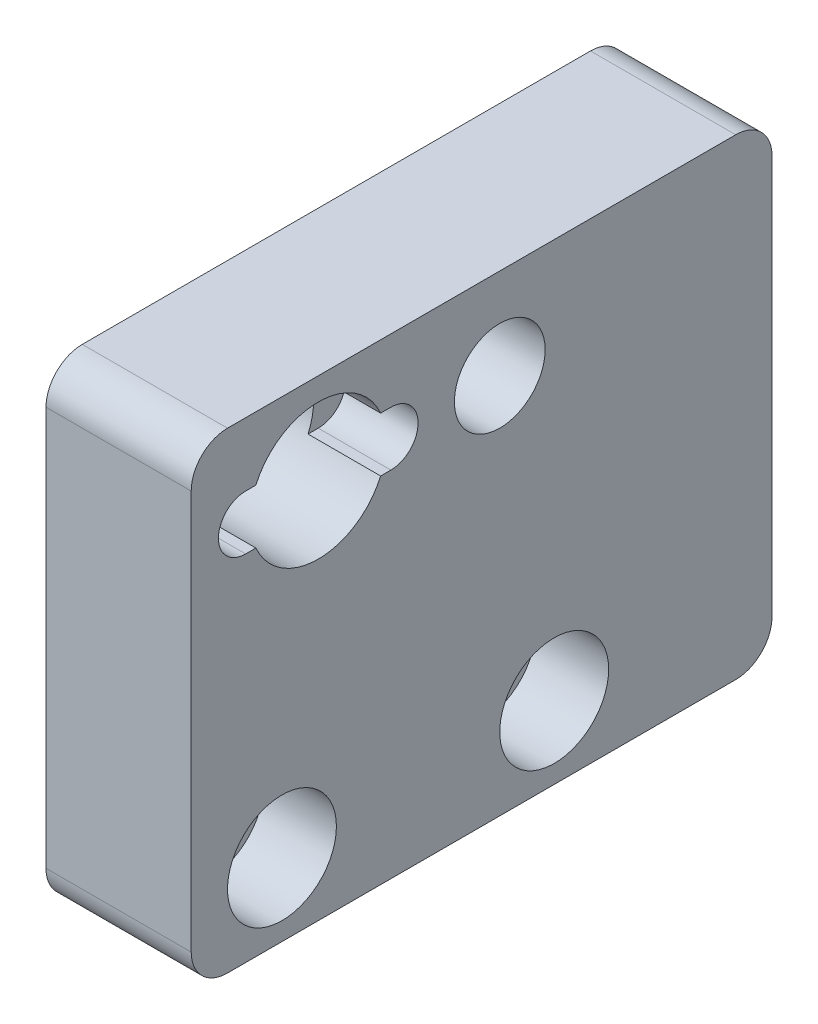
from build123d import *

# Parameters (mm, degrees)
SKETCH1_W                 = 32
SKETCH1_H                 = 26
BOSS_EXTRUDE1_DEPTH       = 8
SKETCH2_R                 = 3
CUT_EXTRUDE1_DEPTH        = 4
SKETCH2_3_R               = 1.6
CUT_EXTRUDE2_DEPTH        = 8
FILLET1_R                 = 2
SKETCH3_R                 = 2.5
CUT_EXTRUDE3_DEPTH        = 8
SKETCH4_R                 = 3.75
CUT_EXTRUDE4_DEPTH        = 8
CUT_EXTRUDE5_DEPTH        = 4
F_2_0MM_DOWEL_HOLE1_D     = 2
F_2_0MM_DOWEL_HOLE1_DEPTH = 6
F_2_0MM_DOWEL_HOLE1_TIP   = 0.600860619
CUT_EXTRUDE6_DEPTH        = 4


with BuildPart() as part:
    # Sketch1 → Boss-Extrude1 (new body)
    with BuildSketch(Plane(origin=(0, 0, 0), x_dir=(0, 0, -1), z_dir=(1, 0, 0))):
        with Locations((16, 13)):
            Rectangle(SKETCH1_W, SKETCH1_H)
    extrude(amount=BOSS_EXTRUDE1_DEPTH)

    # Sketch2 → Cut-Extrude1 (cut)
    with BuildSketch(Plane(origin=(8, 0, 0), x_dir=(0, 0, -1), z_dir=(1, 0, 0))):
        with Locations((20, 4)):
            Circle(SKETCH2_R)
        with Locations((5, 4)):
            Circle(SKETCH2_R)
    extrude(amount=-CUT_EXTRUDE1_DEPTH, mode=Mode.SUBTRACT)

    # Sketch2<3> → Cut-Extrude2 (cut)
    with BuildSketch(Plane(origin=(8, 0, 0), x_dir=(0, 0, -1), z_dir=(1, 0, 0))):
        with Locations((20, 4)):
            Circle(SKETCH2_3_R)
        with Locations((5, 4)):
            Circle(SKETCH2_3_R)
    extrude(amount=-CUT_EXTRUDE2_DEPTH, mode=Mode.SUBTRACT)

    # Fillet1
    fillet1_edges = [part.edges().sort_by_distance(p)[0] for p in [
        (4, 0, 0),
        (4, 0, -32),
        (4, 26, -32),
        (4, 26, 0),
    ]]
    fillet(fillet1_edges, radius=FILLET1_R)

    # Sketch3 → Cut-Extrude3 (cut)
    with BuildSketch(Plane(origin=(8, 0, 0), x_dir=(0, 0, -1), z_dir=(1, 0, 0))):
        with Locations((17, 21)):
            Circle(SKETCH3_R)
    extrude(amount=-CUT_EXTRUDE3_DEPTH, mode=Mode.SUBTRACT)

    # Sketch4 → Cut-Extrude4 (cut)
    with BuildSketch(Plane(origin=(8, 0, 0), x_dir=(0, 0, -1), z_dir=(1, 0, 0))):
        with Locations((7, 21)):
            Circle(SKETCH4_R)
    extrude(amount=-CUT_EXTRUDE4_DEPTH, mode=Mode.SUBTRACT)

    # Sketch4<3> → Cut-Extrude5 (cut)
    with BuildSketch(Plane(origin=(8, 0, 0), x_dir=(0, 0, -1), z_dir=(1, 0, 0))):
        with BuildLine():
            Line((3, 22.5), (11, 22.5))
            ThreePointArc((11, 22.5), (12.5, 21), (11, 19.5))
            Line((11, 19.5), (3, 19.5))
            ThreePointArc((3, 19.5), (1.5, 21), (3, 22.5))
        make_face()
    extrude(amount=-CUT_EXTRUDE5_DEPTH, mode=Mode.SUBTRACT)

    # Ø2.0mm Dowel Hole1
    with Locations(Plane(origin=(0, 0, -32), x_dir=(-1, 0, 0), z_dir=(0, 0, -1))):
        with Locations((-6, 3)):
            Hole(F_2_0MM_DOWEL_HOLE1_D / 2, depth=F_2_0MM_DOWEL_HOLE1_DEPTH)
            with Locations((0, 0, -(F_2_0MM_DOWEL_HOLE1_DEPTH + F_2_0MM_DOWEL_HOLE1_TIP / 2))):  # 118° drill point
                Cone(0, F_2_0MM_DOWEL_HOLE1_D / 2, F_2_0MM_DOWEL_HOLE1_TIP, mode=Mode.SUBTRACT)

    # Sketch15 → Cut-Extrude6 (cut)
    with BuildSketch(Plane.ZY):
        with BuildLine():
            Line((-15, 4), (-10, 4))
            ThreePointArc((-10, 4), (-9.5, 3.5), (-10, 3))
            Line((-10, 3), (-10, 0))
            Line((-10, 0), (-15, 0))
            Line((-15, 0), (-15, 3))
            ThreePointArc((-15, 3), (-15.5, 3.5), (-15, 4))
        make_face()
    extrude(amount=-CUT_EXTRUDE6_DEPTH, mode=Mode.SUBTRACT)


solid = part.part
